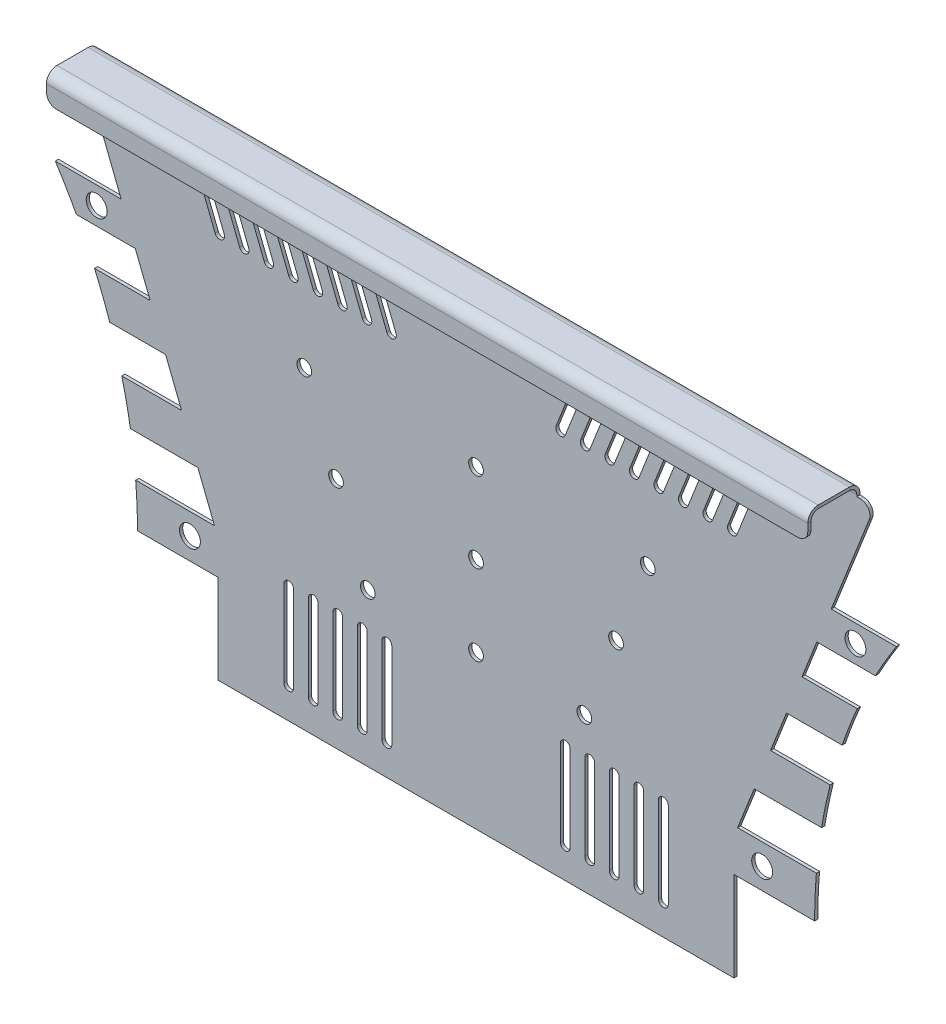
from build123d import *

# Parameters (mm, degrees)
BASE_FLANGE1_DEPTH            = 1.3
SKETCH6_R                     = 4.25
CUT_EXTRUDE1_DEPTH            = 10
CUT_EXTRUDE2_DEPTH            = 10
SKETCH8_R                     = 3
CUT_EXTRUDE3_DEPTH            = 10
EDGE_FLANGE1_STRIP_W          = 13.200000192
EDGE_FLANGE1_STRIP_H          = 1.3
EDGE_FLANGE1_STRIP_CUT_DEPTH  = 310.300300198
EDGE_FLANGE1_RELIEF_W         = 13.850000192
EDGE_FLANGE1_RELIEF_H         = 10.65
EDGE_FLANGE1_RELIEF_CUT_DEPTH = 1.3
EDGE_FLANGE1_DEPTH            = 310.300300198
EDGE_FLANGE2_STRIP_W          = 11.200000192
EDGE_FLANGE2_STRIP_H          = 1.3
EDGE_FLANGE2_STRIP_CUT_DEPTH  = 310.300300198
EDGE_FLANGE2_DEPTH            = 310.300300198
FILLET2_R                     = 4


# Sheet-metal steps are written as plain solids
with BuildPart() as part:
    # Sketch1 → Base-Flange1 (new body)
    with BuildSketch(Plane.XY):
        with BuildLine():
            Line((0, 201.87), (330.300300198, 201.87))
            Line((330.300300198, 201.87), (309.846474375, 150.072776754))
            Line((309.846474375, 150.072776754), (336.421468308, 150.072776754))
            ThreePointArc((336.421468308, 150.072776754), (332.001029353, 142.87833379), (327.873388791, 135.512))
            Line((327.873388791, 135.512), (303.983630737, 135.512))
            Line((303.983630737, 135.512), (297.933517086, 120.198153998))
            Line((297.933517086, 120.198153998), (320.473434479, 120.198153998))
            ThreePointArc((320.473434479, 120.198153998), (317.227818368, 112.285764187), (314.307056654, 104.247786364))
            Line((314.307056654, 104.247786364), (291.631929821, 104.247786364))
            Line((291.631929821, 104.247786364), (285.126827823, 87.782289026))
            Line((285.126827823, 87.782289026), (309.442242986, 87.782289026))
            ThreePointArc((309.442242986, 87.782289026), (307.513745019, 79.390632511), (305.930869729, 70.92697436))
            Line((305.930869729, 70.92697436), (278.467718849, 70.92697436))
            Line((278.467718849, 70.92697436), (271.705282738, 53.81012149))
            Line((271.705282738, 53.81012149), (303.809526483, 53.81012149))
            ThreePointArc((303.809526483, 53.81012149), (303.277456599, 45.193354511), (303.1, 36.562))
            Line((303.1, 36.562), (270.2, 36.562))
            Line((270.2, 36.562), (270.2, 0))
            Line((270.2, 0), (60, 0))
            Line((60, 0), (60, 36.308))
            Line((60, 36.308), (27.1, 36.308))
            ThreePointArc((27.1, 36.308), (26.917266893, 45.066682179), (26.369385586, 53.81012149))
            Line((26.369385586, 53.81012149), (58.494717262, 53.81012149))
            Line((58.494717262, 53.81012149), (51.732281151, 70.92697436))
            Line((51.732281151, 70.92697436), (24.226837021, 70.92697436))
            ThreePointArc((24.226837021, 70.92697436), (22.633128104, 79.390864945), (20.693707096, 87.782289026))
            Line((20.693707096, 87.782289026), (45.073172177, 87.782289026))
            Line((45.073172177, 87.782289026), (38.568070179, 104.247786364))
            Line((38.568070179, 104.247786364), (15.806279289, 104.247786364))
            ThreePointArc((15.806279289, 104.247786364), (12.87368993, 112.286038481), (9.616082606, 120.198153998))
            Line((9.616082606, 120.198153998), (32.266482914, 120.198153998))
            Line((32.266482914, 120.198153998), (26.216369263, 135.512))
            Line((26.216369263, 135.512), (2.190697724, 135.512))
            ThreePointArc((2.190697724, 135.512), (-1.950587863, 142.878681931), (-6.384914044, 150.072776754))
            Line((-6.384914044, 150.072776754), (20.463774246, 150.072776754))
            Line((20.463774246, 150.072776754), (0, 201.87))
        make_face()
    extrude(amount=BASE_FLANGE1_DEPTH)

    # Sketch6 → Cut-Extrude1 (cut)
    with BuildSketch(Plane.XY.offset(1.3)):
        with Locations((10.463774246, 142.792388377)):
            Circle(SKETCH6_R)
        with Locations((48.494717262, 45.186060745)):
            Circle(SKETCH6_R)
        with Locations((281.705282738, 45.186060745)):
            Circle(SKETCH6_R)
        with Locations((319.736225754, 142.792388377)):
            Circle(SKETCH6_R)
    extrude(amount=-CUT_EXTRUDE1_DEPTH, mode=Mode.SUBTRACT)

    # Sketch7 → Cut-Extrude2 (cut)
    with BuildSketch(Plane.XY.offset(1.3)):
        with BuildLine():
            Line((128.751480442, 157.184405338), (117.728328134, 185.085841021))
            ThreePointArc((117.728328134, 185.085841021), (118.853547026, 187.680813554), (121.448519558, 186.555594662))
            Line((121.448519558, 186.555594662), (132.471671866, 158.654158979))
            ThreePointArc((132.471671866, 158.654158979), (131.346452974, 156.059186446), (128.751480442, 157.184405338))
        make_face()
        with BuildLine():
            Line((118.751480442, 157.184405338), (107.728328134, 185.085841021))
            ThreePointArc((107.728328134, 185.085841021), (108.853547026, 187.680813554), (111.448519558, 186.555594662))
            Line((111.448519558, 186.555594662), (122.471671866, 158.654158979))
            ThreePointArc((122.471671866, 158.654158979), (121.346452974, 156.059186446), (118.751480442, 157.184405338))
        make_face()
        with BuildLine():
            Line((108.751480442, 157.184405338), (97.728328134, 185.085841021))
            ThreePointArc((97.728328134, 185.085841021), (98.853547026, 187.680813554), (101.448519558, 186.555594662))
            Line((101.448519558, 186.555594662), (112.471671866, 158.654158979))
            ThreePointArc((112.471671866, 158.654158979), (111.346452974, 156.059186446), (108.751480442, 157.184405338))
        make_face()
        with BuildLine():
            Line((98.751480442, 157.184405338), (87.728328134, 185.085841021))
            ThreePointArc((87.728328134, 185.085841021), (88.853547026, 187.680813554), (91.448519558, 186.555594662))
            Line((91.448519558, 186.555594662), (102.471671866, 158.654158979))
            ThreePointArc((102.471671866, 158.654158979), (101.346452974, 156.059186446), (98.751480442, 157.184405338))
        make_face()
        with BuildLine():
            Line((88.751480442, 157.184405338), (77.728328134, 185.085841021))
            ThreePointArc((77.728328134, 185.085841021), (78.853547026, 187.680813554), (81.448519558, 186.555594662))
            Line((81.448519558, 186.555594662), (92.471671866, 158.654158979))
            ThreePointArc((92.471671866, 158.654158979), (91.346452974, 156.059186446), (88.751480442, 157.184405338))
        make_face()
        with BuildLine():
            Line((78.751480442, 157.184405338), (67.728328134, 185.085841021))
            ThreePointArc((67.728328134, 185.085841021), (68.853547026, 187.680813554), (71.448519558, 186.555594662))
            Line((71.448519558, 186.555594662), (82.471671866, 158.654158979))
            ThreePointArc((82.471671866, 158.654158979), (81.346452974, 156.059186446), (78.751480442, 157.184405338))
        make_face()
        with BuildLine():
            Line((68.751480442, 157.184405338), (57.728328134, 185.085841021))
            ThreePointArc((57.728328134, 185.085841021), (58.853547026, 187.680813554), (61.448519558, 186.555594662))
            Line((61.448519558, 186.555594662), (72.471671866, 158.654158979))
            ThreePointArc((72.471671866, 158.654158979), (71.346452974, 156.059186446), (68.751480442, 157.184405338))
        make_face()
        with BuildLine():
            Line((58.751480442, 157.184405338), (47.728328134, 185.085841021))
            ThreePointArc((47.728328134, 185.085841021), (48.853547026, 187.680813554), (51.448519558, 186.555594662))
            Line((51.448519558, 186.555594662), (62.471671866, 158.654158979))
            ThreePointArc((62.471671866, 158.654158979), (61.346452974, 156.059186446), (58.751480442, 157.184405338))
        make_face()
        with BuildLine():
            Line((126.751480442, 12.5), (126.751480442, 47.5))
            ThreePointArc((126.751480442, 47.5), (128.751480442, 49.5), (130.751480442, 47.5))
            Line((130.751480442, 47.5), (130.751480442, 12.5))
            ThreePointArc((130.751480442, 12.5), (128.751480442, 10.5), (126.751480442, 12.5))
        make_face()
        with BuildLine():
            Line((116.751480442, 12.5), (116.751480442, 47.5))
            ThreePointArc((116.751480442, 47.5), (118.751480442, 49.5), (120.751480442, 47.5))
            Line((120.751480442, 47.5), (120.751480442, 12.5))
            ThreePointArc((120.751480442, 12.5), (118.751480442, 10.5), (116.751480442, 12.5))
        make_face()
        with BuildLine():
            Line((106.751480442, 12.5), (106.751480442, 47.5))
            ThreePointArc((106.751480442, 47.5), (108.751480442, 49.5), (110.751480442, 47.5))
            Line((110.751480442, 47.5), (110.751480442, 12.5))
            ThreePointArc((110.751480442, 12.5), (108.751480442, 10.5), (106.751480442, 12.5))
        make_face()
        with BuildLine():
            Line((96.751480442, 12.5), (96.751480442, 47.5))
            ThreePointArc((96.751480442, 47.5), (98.751480442, 49.5), (100.751480442, 47.5))
            Line((100.751480442, 47.5), (100.751480442, 12.5))
            ThreePointArc((100.751480442, 12.5), (98.751480442, 10.5), (96.751480442, 12.5))
        make_face()
        with BuildLine():
            Line((86.751480442, 12.5), (86.751480442, 47.5))
            ThreePointArc((86.751480442, 47.5), (88.751480442, 49.5), (90.751480442, 47.5))
            Line((90.751480442, 47.5), (90.751480442, 12.5))
            ThreePointArc((90.751480442, 12.5), (88.751480442, 10.5), (86.751480442, 12.5))
        make_face()
        with BuildLine():
            Line((201.448519558, 157.184405338), (212.471671866, 185.085841021))
            ThreePointArc((212.471671866, 185.085841021), (211.346452974, 187.680813554), (208.751480442, 186.555594662))
            Line((208.751480442, 186.555594662), (197.728328134, 158.654158979))
            ThreePointArc((197.728328134, 158.654158979), (198.853547026, 156.059186446), (201.448519558, 157.184405338))
        make_face()
        with BuildLine():
            Line((211.448519558, 157.184405338), (222.471671866, 185.085841021))
            ThreePointArc((222.471671866, 185.085841021), (221.346452974, 187.680813554), (218.751480442, 186.555594662))
            Line((218.751480442, 186.555594662), (207.728328134, 158.654158979))
            ThreePointArc((207.728328134, 158.654158979), (208.853547026, 156.059186446), (211.448519558, 157.184405338))
        make_face()
        with BuildLine():
            Line((221.448519558, 157.184405338), (232.471671866, 185.085841021))
            ThreePointArc((232.471671866, 185.085841021), (231.346452974, 187.680813554), (228.751480442, 186.555594662))
            Line((228.751480442, 186.555594662), (217.728328134, 158.654158979))
            ThreePointArc((217.728328134, 158.654158979), (218.853547026, 156.059186446), (221.448519558, 157.184405338))
        make_face()
        with BuildLine():
            Line((231.448519558, 157.184405338), (242.471671866, 185.085841021))
            ThreePointArc((242.471671866, 185.085841021), (241.346452974, 187.680813554), (238.751480442, 186.555594662))
            Line((238.751480442, 186.555594662), (227.728328134, 158.654158979))
            ThreePointArc((227.728328134, 158.654158979), (228.853547026, 156.059186446), (231.448519558, 157.184405338))
        make_face()
        with BuildLine():
            Line((241.448519558, 157.184405338), (252.471671866, 185.085841021))
            ThreePointArc((252.471671866, 185.085841021), (251.346452974, 187.680813554), (248.751480442, 186.555594662))
            Line((248.751480442, 186.555594662), (237.728328134, 158.654158979))
            ThreePointArc((237.728328134, 158.654158979), (238.853547026, 156.059186446), (241.448519558, 157.184405338))
        make_face()
        with BuildLine():
            Line((251.448519558, 157.184405338), (262.471671866, 185.085841021))
            ThreePointArc((262.471671866, 185.085841021), (261.346452974, 187.680813554), (258.751480442, 186.555594662))
            Line((258.751480442, 186.555594662), (247.728328134, 158.654158979))
            ThreePointArc((247.728328134, 158.654158979), (248.853547026, 156.059186446), (251.448519558, 157.184405338))
        make_face()
        with BuildLine():
            Line((261.448519558, 157.184405338), (272.471671866, 185.085841021))
            ThreePointArc((272.471671866, 185.085841021), (271.346452974, 187.680813554), (268.751480442, 186.555594662))
            Line((268.751480442, 186.555594662), (257.728328134, 158.654158979))
            ThreePointArc((257.728328134, 158.654158979), (258.853547026, 156.059186446), (261.448519558, 157.184405338))
        make_face()
        with BuildLine():
            Line((271.448519558, 157.184405338), (282.471671866, 185.085841021))
            ThreePointArc((282.471671866, 185.085841021), (281.346452974, 187.680813554), (278.751480442, 186.555594662))
            Line((278.751480442, 186.555594662), (267.728328134, 158.654158979))
            ThreePointArc((267.728328134, 158.654158979), (268.853547026, 156.059186446), (271.448519558, 157.184405338))
        make_face()
        with BuildLine():
            Line((203.448519558, 12.5), (203.448519558, 47.5))
            ThreePointArc((203.448519558, 47.5), (201.448519558, 49.5), (199.448519558, 47.5))
            Line((199.448519558, 47.5), (199.448519558, 12.5))
            ThreePointArc((199.448519558, 12.5), (201.448519558, 10.5), (203.448519558, 12.5))
        make_face()
        with BuildLine():
            Line((213.448519558, 12.5), (213.448519558, 47.5))
            ThreePointArc((213.448519558, 47.5), (211.448519558, 49.5), (209.448519558, 47.5))
            Line((209.448519558, 47.5), (209.448519558, 12.5))
            ThreePointArc((209.448519558, 12.5), (211.448519558, 10.5), (213.448519558, 12.5))
        make_face()
        with BuildLine():
            Line((223.448519558, 12.5), (223.448519558, 47.5))
            ThreePointArc((223.448519558, 47.5), (221.448519558, 49.5), (219.448519558, 47.5))
            Line((219.448519558, 47.5), (219.448519558, 12.5))
            ThreePointArc((219.448519558, 12.5), (221.448519558, 10.5), (223.448519558, 12.5))
        make_face()
        with BuildLine():
            Line((233.448519558, 12.5), (233.448519558, 47.5))
            ThreePointArc((233.448519558, 47.5), (231.448519558, 49.5), (229.448519558, 47.5))
            Line((229.448519558, 47.5), (229.448519558, 12.5))
            ThreePointArc((229.448519558, 12.5), (231.448519558, 10.5), (233.448519558, 12.5))
        make_face()
        with BuildLine():
            Line((243.448519558, 12.5), (243.448519558, 47.5))
            ThreePointArc((243.448519558, 47.5), (241.448519558, 49.5), (239.448519558, 47.5))
            Line((239.448519558, 47.5), (239.448519558, 12.5))
            ThreePointArc((239.448519558, 12.5), (241.448519558, 10.5), (243.448519558, 12.5))
        make_face()
    extrude(amount=-CUT_EXTRUDE2_DEPTH, mode=Mode.SUBTRACT)

    # Sketch8 → Cut-Extrude3 (cut)
    with BuildSketch(Plane.XY.offset(1.3)):
        with Locations((95.1, 127.855076999)):
            Circle(SKETCH8_R)
        with Locations((108.036036559, 95.111812462)):
            Circle(SKETCH8_R)
        with Locations((120.972073118, 62.368547925)):
            Circle(SKETCH8_R)
        with Locations((209.227926882, 62.368547925)):
            Circle(SKETCH8_R)
        with Locations((222.163963441, 95.111812462)):
            Circle(SKETCH8_R)
        with Locations((235.1, 127.855076999)):
            Circle(SKETCH8_R)
        with Locations((165.1, 127.855076999)):
            Circle(SKETCH8_R)
        with Locations((165.1, 95.111812462)):
            Circle(SKETCH8_R)
        with Locations((165.1, 62.368547925)):
            Circle(SKETCH8_R)
    extrude(amount=-CUT_EXTRUDE3_DEPTH, mode=Mode.SUBTRACT)

    # Edge-Flange1 strip (across the edge) → Edge-Flange1 strip cut (cut)
    with BuildSketch(Plane(origin=(320.300300198, 199.87, 1.3), x_dir=(0, -1, 0), z_dir=(-1, 0, 0))):
        with Locations((-2.3, -0.65)):
            Rectangle(EDGE_FLANGE1_STRIP_W, EDGE_FLANGE1_STRIP_H)
    extrude(amount=EDGE_FLANGE1_STRIP_CUT_DEPTH, mode=Mode.SUBTRACT)

    # Edge-Flange1 relief (on the sheet) → Edge-Flange1 relief cut (cut)
    with BuildSketch(Plane(origin=(320.300300198, 195.569999904, 1.3), x_dir=(0, -1, 0), z_dir=(0, 0, 1))):
        with Locations((-6.275000096, 5.325)):
            Rectangle(EDGE_FLANGE1_RELIEF_W, EDGE_FLANGE1_RELIEF_H)
        with Locations((-6.275000096, -315.625300198)):
            Rectangle(EDGE_FLANGE1_RELIEF_W, EDGE_FLANGE1_RELIEF_H)
    extrude(amount=-EDGE_FLANGE1_RELIEF_CUT_DEPTH, mode=Mode.SUBTRACT)

    # Edge-Flange1 section (across the edge) → Edge-Flange1 (add)
    with BuildSketch(Plane(origin=(320.300300198, 199.87, 1.3), x_dir=(0, -1, 0), z_dir=(-1, 0, 0))):
        with BuildLine():
            Line((0, 3.000000096), (0, 20))
            Line((0, 20), (1.3, 20))
            Line((1.3, 20), (1.3, 3.000000096))
            ThreePointArc((1.3, 3.000000096), (2.178679685, 0.878679685), (4.300000096, 0))
            Line((4.300000096, 0), (4.300000096, -1.3))
            ThreePointArc((4.300000096, -1.3), (1.259440869, -0.040559131), (0, 3.000000096))
        make_face()
    extrude(amount=EDGE_FLANGE1_DEPTH)

    # Edge-Flange2 strip (across the edge) → Edge-Flange2 strip cut (cut)
    with BuildSketch(Plane(origin=(320.300300198, 198.57, 21.3), x_dir=(0, 0, -1), z_dir=(-1, 0, 0))):
        with Locations((-1.3, -0.65)):
            Rectangle(EDGE_FLANGE2_STRIP_W, EDGE_FLANGE2_STRIP_H)
    extrude(amount=EDGE_FLANGE2_STRIP_CUT_DEPTH, mode=Mode.SUBTRACT)

    # Edge-Flange2 section (across the edge) → Edge-Flange2 (add)
    with BuildSketch(Plane(origin=(320.300300198, 198.57, 21.3), x_dir=(0, 0, -1), z_dir=(-1, 0, 0))):
        with BuildLine():
            Line((0, 3.000000096), (0, 10))
            Line((0, 10), (1.3, 10))
            Line((1.3, 10), (1.3, 3.000000096))
            ThreePointArc((1.3, 3.000000096), (2.178679685, 0.878679685), (4.300000096, 0))
            Line((4.300000096, 0), (4.300000096, -1.3))
            ThreePointArc((4.300000096, -1.3), (1.259440869, -0.040559131), (0, 3.000000096))
        make_face()
    extrude(amount=EDGE_FLANGE2_DEPTH)

    # Fillet2
    fillet2_edges = [part.edges().sort_by_distance(p)[0] for p in [
        (2.745769446, 194.919999904, 0.65),
        (327.555865603, 194.919999904, 0.65),
        (320.300300198, 188.57, 20.65),
        (10, 188.57, 20.65),
    ]]
    fillet(fillet2_edges, radius=FILLET2_R)


solid = part.part
